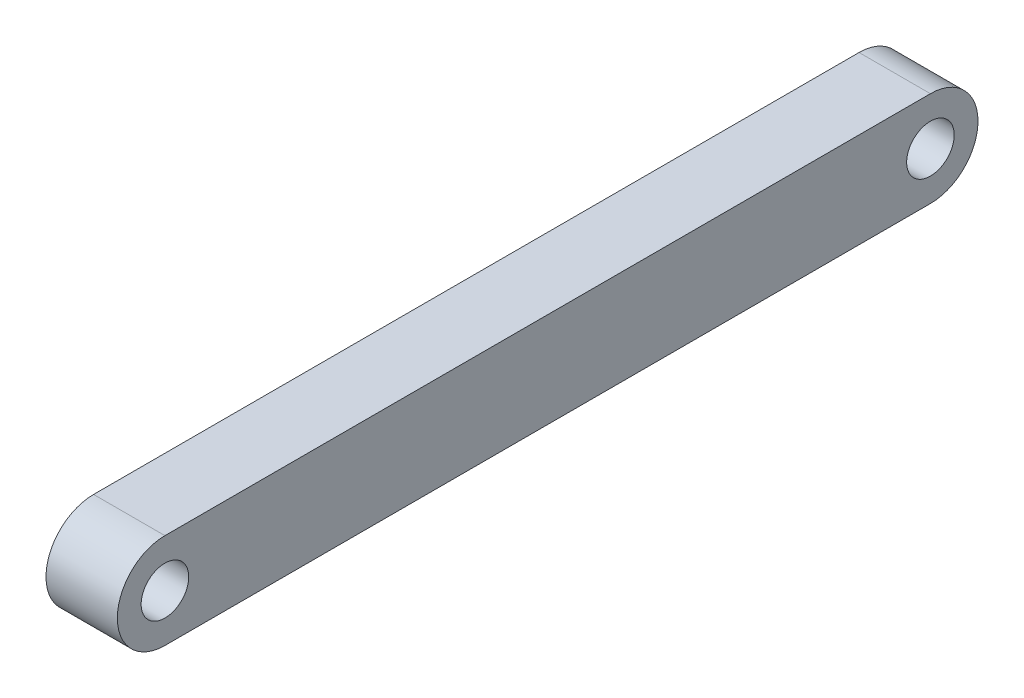
from build123d import *

# Parameters (mm, degrees)
SKETCH1_R           = 1
BOSS_EXTRUDE1_DEPTH = 1.5


with BuildPart() as part:
    # Sketch1 → Boss-Extrude1 (new, symmetric)
    with BuildSketch(Plane(origin=(0, 0, 0), x_dir=(0, 0, -1), z_dir=(1, 0, 0))):
        with BuildLine():
            Line((-16.09, -2), (16.09, -2))
            ThreePointArc((16.09, -2), (18.09, 0), (16.09, 2))
            Line((16.09, 2), (-16.09, 2))
            ThreePointArc((-16.09, 2), (-18.09, 0), (-16.09, -2))
        make_face()
        with Locations((-16.09, 0)):
            Circle(SKETCH1_R, mode=Mode.SUBTRACT)
        with Locations((16.09, 0)):
            Circle(SKETCH1_R, mode=Mode.SUBTRACT)
    extrude(amount=BOSS_EXTRUDE1_DEPTH, both=True)


solid = part.part
